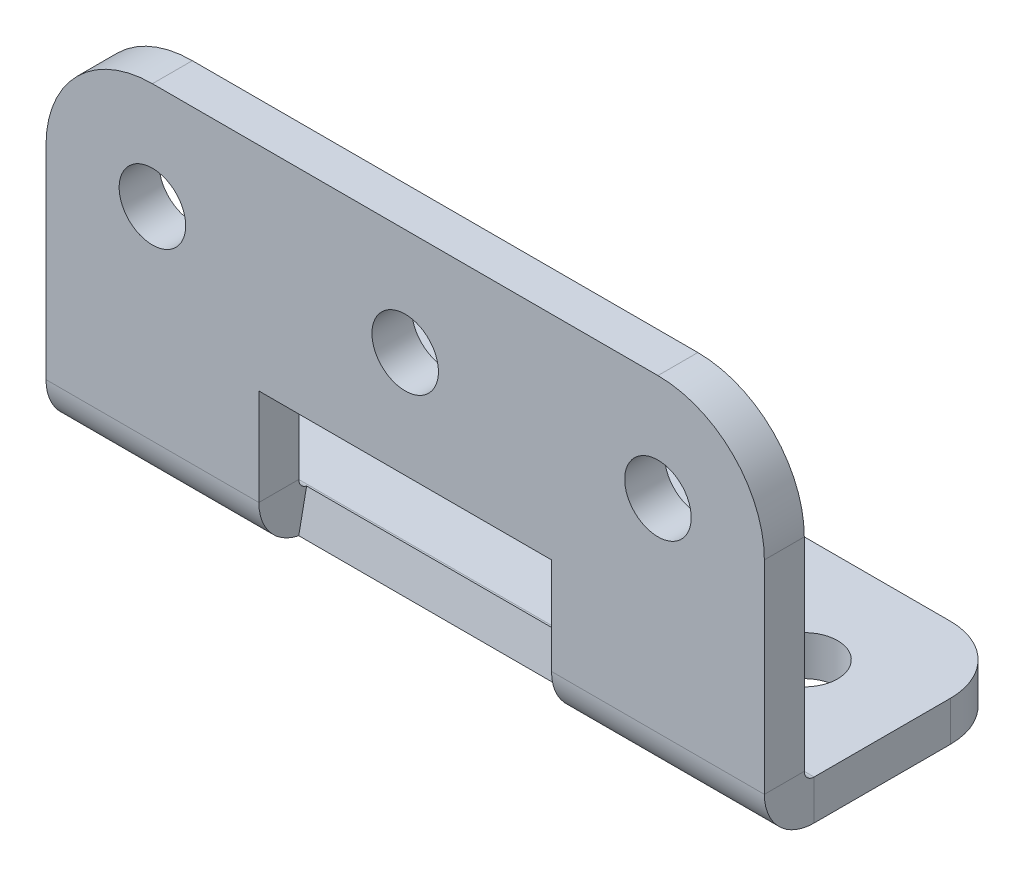
from build123d import *

# Parameters (mm, degrees)
SKETCH1_R                    = 2.5
BASE_FLANGE1_DEPTH           = 3
EDGE_FLANGE1_STRIP_W         = 13.4732
EDGE_FLANGE1_STRIP_H         = 3
EDGE_FLANGE1_STRIP_CUT_DEPTH = 54
EDGE_FLANGE1_DEPTH           = 54
CUT_EXTRUDE1_START           = 16
CUT_EXTRUDE1_DEPTH           = 22
SKETCH10_R                   = 2.5
CUT_EXTRUDE2_DEPTH           = 10
SKETCH11_W                   = 22
SKETCH11_H                   = 16
SKETCH11_R                   = 2.5
BOSS_EXTRUDE1_DEPTH          = 3


# Read off the part's stored shape, not the designer's step: Cut-Extrude1
# Sheet-metal steps are written as plain solids
with BuildPart() as part:
    # Sketch1 → Base-Flange1 (new body)
    with BuildSketch(Plane(origin=(0, 0, 0), x_dir=(1, 0, 0), z_dir=(0, 1, 0))):
        with BuildLine():
            Line((0, 0), (54, 0))
            Line((54, 0), (54, 11))
            ThreePointArc((54, 11), (52.535533906, 14.535533906), (49, 16))
            Line((49, 16), (5, 16))
            ThreePointArc((5, 16), (1.464466094, 14.535533906), (0, 11))
            Line((0, 11), (0, 0))
        make_face()
        with Locations(Location((8, 8, 0), (0, 0, 270))):
            Circle(SKETCH1_R, mode=Mode.SUBTRACT)
        with Locations(Location((46, 8, 0), (0, 0, 90))):
            Circle(SKETCH1_R, mode=Mode.SUBTRACT)
    extrude(amount=-BASE_FLANGE1_DEPTH)

    # Edge-Flange1 strip (across the edge) → Edge-Flange1 strip cut (cut)
    with BuildSketch(Plane(origin=(0, 0, 0), x_dir=(0, 0, -1), z_dir=(1, 0, 0))):
        with Locations((-6, -1.5)):
            Rectangle(EDGE_FLANGE1_STRIP_W, EDGE_FLANGE1_STRIP_H)
    extrude(amount=EDGE_FLANGE1_STRIP_CUT_DEPTH, mode=Mode.SUBTRACT)

    # Edge-Flange1 section (across the edge) → Edge-Flange1 (add)
    with BuildSketch(Plane(origin=(0, 0, 0), x_dir=(0, 0, -1), z_dir=(1, 0, 0))):
        with BuildLine():
            Line((-3, 0.7366), (-3, 24))
            Line((-3, 24), (0, 24))
            Line((0, 24), (0, 0.7366))
            ThreePointArc((0, 0.7366), (0.215745145, 0.215745145), (0.7366, 0))
            Line((0.7366, 0), (0.7366, -3))
            ThreePointArc((0.7366, -3), (-1.905575199, -1.905575199), (-3, 0.7366))
        make_face()
    extrude(amount=EDGE_FLANGE1_DEPTH)

    # Cut-Extrude1 outline → Cut-Extrude1 (cut)
    with BuildSketch(Plane.YZ.offset(CUT_EXTRUDE1_START)):
        with BuildLine():
            Line((-2.926677222, 0), (0.014454199, -0.591393245))
            ThreePointArc((0.014454199, -0.591393245), (0.269898669, -0.166714548), (0.7366, 0))
            Line((0.7366, 0), (24, 0))
            Line((24, 0), (24, 3))
            Line((24, 3), (0.7366, 3))
            ThreePointArc((0.7366, 3), (-1.630867001, 2.154295979), (-2.926677222, 0))
        make_face()
    extrude(amount=CUT_EXTRUDE1_DEPTH, mode=Mode.SUBTRACT)

    # Sketch10 → Cut-Extrude2 (cut)
    with BuildSketch(Plane.XY.offset(3)):
        with BuildLine():
            ThreePointArc((46, 24), (51.656854249, 21.656854249), (54, 16))
            Line((54, 16), (54, 24))
            Line((54, 24), (46, 24))
        make_face()
        with Locations((46, 16)):
            Circle(SKETCH10_R)
        with Locations((8, 16)):
            Circle(SKETCH10_R)
        with BuildLine():
            ThreePointArc((0, 16), (2.343145751, 21.656854249), (8, 24))
            Line((8, 24), (0, 24))
            Line((0, 24), (0, 16))
        make_face()
    extrude(amount=-CUT_EXTRUDE2_DEPTH, mode=Mode.SUBTRACT)

    # Sketch11 → Boss-Extrude1 (add)
    with BuildSketch(Plane.XY.offset(3)):
        with Locations((27, 16)):
            Rectangle(SKETCH11_W, SKETCH11_H)
        with Locations((27, 16)):
            Circle(SKETCH11_R, mode=Mode.SUBTRACT)
    extrude(amount=-BOSS_EXTRUDE1_DEPTH)


solid = part.part
